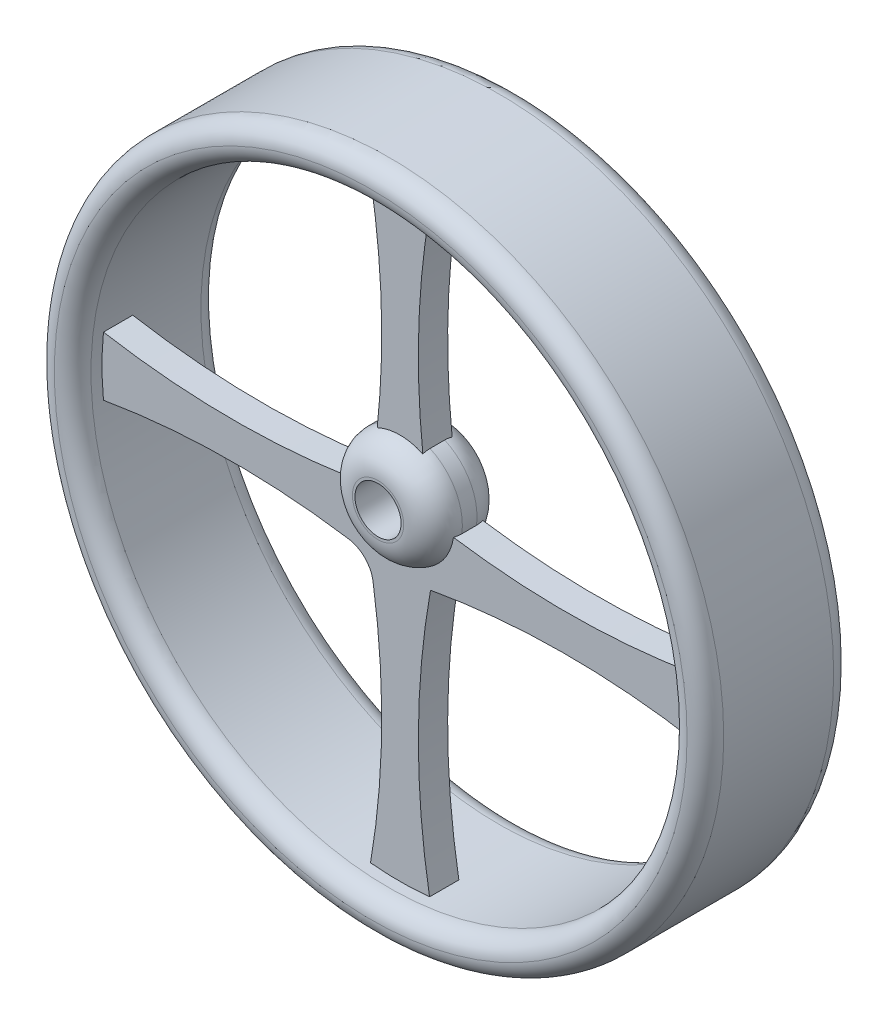
from build123d import *

# Parameters (mm, degrees)
BOSS_EXTRUDE2_DEPTH      = 3.81
BOSS_EXTRUDE2_DEPTH_BACK = 8.89
SKETCH1_R                = 28.999999992
SKETCH1_R_2              = 25.824999992
SKETCH8_R                = 4.7625
BOSS_EXTRUDE3_DEPTH      = 3.175
BOSS_EXTRUDE4_DEPTH      = 1.27
CIRPATTERN1_COUNT        = 4
F_3_0MM_DOWEL_HOLE2_D    = 4
FILLET1_R                = 1.5875
FILLET2_R                = 2.54


# Some blends are built 0.0001 mm under size
with BuildPart() as part:
    # Sketch1 → Boss-Extrude2 (new, two sides: drawn at the far end of the back side and taken through both)
    with BuildSketch(Plane.XY.offset(-BOSS_EXTRUDE2_DEPTH_BACK)):
        Circle(SKETCH1_R)
        Circle(SKETCH1_R_2, mode=Mode.SUBTRACT)
    extrude(amount=BOSS_EXTRUDE2_DEPTH + BOSS_EXTRUDE2_DEPTH_BACK)



with BuildPart() as body_2:
    # Sketch8 → Boss-Extrude3 (new, symmetric)
    with BuildSketch(Plane.XY):
        with Locations((0, 3)):
            Circle(SKETCH8_R)
    extrude(amount=BOSS_EXTRUDE3_DEPTH, both=True)


with BuildPart() as part_1:
    add(part.part)

    add(body_2.part)  # Boss-Extrude4 merges body 2
    # Sketch9 → Boss-Extrude4 (add, symmetric)
    with BuildSketch(Plane.XY):
        with BuildLine():
            Line((3.175, 0), (-3.175, 0))
            ThreePointArc((-3.175, 0), (-1.5875, 14.412836072), (-3.175, 28.825672144))
            Line((-3.175, 28.825672144), (3.175, 28.825672144))
            ThreePointArc((3.175, 28.825672144), (1.5875, 14.412836072), (3.175, 0))
        make_face()
    boss_extrude4 = extrude(amount=BOSS_EXTRUDE4_DEPTH, both=True)

    # CirPattern1: Boss-Extrude4 ×4 about axis
    cirpattern1_axis = Axis((0, 0, 0), (0, 0, 1))
    for i in range(1, CIRPATTERN1_COUNT):
        add(boss_extrude4.rotate(cirpattern1_axis, i * 360 / CIRPATTERN1_COUNT))

    # Ø3.0mm Dowel Hole2 (through all)
    with Locations(Plane.XY.offset(3.175)):
        with Locations((0, 3)):
            Hole(F_3_0MM_DOWEL_HOLE2_D / 2)

    # Fillet1
    fillet1_edges = [part_1.edges().sort_by_distance(p)[0] for p in [
        (-28.999999992, 0, -8.89),
        (-25.824999992, 0, -8.89),
        (-28.999999992, 0, 3.81),
        (-25.824999992, 0, 3.81),
    ]]
    fillet(fillet1_edges, radius=FILLET1_R - 0.0001)  # a hair under: the kernel refuses the full size

    # Fillet2
    # the kernel refuses this fillet: 2.54 mm, written as the material it adds along each edge
    with BuildSketch(Plane(origin=(-2.642036236, -2.642036236, -1.27), x_dir=(-0.9864638290432723, 0.16397900472098711, 0), z_dir=(0, 0, 1))) as fillet2_piece_1:
        with BuildLine():
            CenterArc((1.815741987, 2.539751853), FILLET2_R, 198.074955273, 72.725945295)
            ThreePointArc((-0.598912674, 1.751689123), (-0.305577869, 0.873751575), (0, 0))
            ThreePointArc((0, 0), (0.925622922, -0.006469447), (1.851245845, 0))
        make_face()
    extrude(amount=2.54)
    # the kernel refuses this fillet: 2.54 mm, written as the material it takes off along each edge
    with BuildSketch(Plane(origin=(0, 3, -3.175), x_dir=(1, 0, 0), z_dir=(0, -1, 0))) as fillet2_2_piece_1_section:
        with BuildLine():
            CenterArc((4.7625 - FILLET2_R, FILLET2_R), FILLET2_R, 270, 90)
            Line((4.7625 - FILLET2_R, 0), (4.7625, 0))
            Line((4.7625, 0), (4.7625, FILLET2_R))
        make_face()
    fillet2_2_piece_1 = revolve(axis=Axis((0, 3, -3.175), (0, 0, 1)), mode=Mode.PRIVATE)
    fillet2_2_piece_1 = fillet2_2_piece_1 & Plane(origin=(14.412836072, 67.807972404, -0.955463764), x_dir=(-0.21764924876751077, -0.9760270511163809, 0), z_dir=(0, 0, 1)) * Cylinder(66.220472404, 20, mode=Mode.PRIVATE)
    fillet2_2_piece_1 = fillet2_2_piece_1 - Plane(origin=(-14.412836072, 67.807972404, -0.955463764), x_dir=(-0.21764924876750993, -0.9760270511163811, 0), z_dir=(0, 0, 1)) * Cylinder(66.220472404, 20, mode=Mode.PRIVATE)
    add(fillet2_2_piece_1, mode=Mode.SUBTRACT)
    with BuildSketch(Plane(origin=(0, 3, -3.175), x_dir=(1, 0, 0), z_dir=(0, -1, 0))) as fillet2_2_piece_2_section:
        with BuildLine():
            CenterArc((4.7625 - FILLET2_R, FILLET2_R), FILLET2_R, 270, 90)
            Line((4.7625 - FILLET2_R, 0), (4.7625, 0))
            Line((4.7625, 0), (4.7625, FILLET2_R))
        make_face()
    fillet2_2_piece_2 = revolve(axis=Axis((0, 3, -3.175), (0, 0, 1)), mode=Mode.PRIVATE)
    fillet2_2_piece_2 = fillet2_2_piece_2 & Plane(origin=(67.807972404, 14.412836072, -0.955566324), x_dir=(-0.9760270511163811, 0.21764924876750982, 0), z_dir=(0, 0, 1)) * Cylinder(66.220472404, 20, mode=Mode.PRIVATE)
    fillet2_2_piece_2 = fillet2_2_piece_2 & Plane(origin=(-14.412836072, 67.807972404, -0.955566324), x_dir=(-0.21764924876750993, -0.9760270511163811, 0), z_dir=(0, 0, 1)) * Cylinder(66.220472404, 20, mode=Mode.PRIVATE)
    add(fillet2_2_piece_2, mode=Mode.SUBTRACT)
    with BuildSketch(Plane(origin=(0, 3, -3.175), x_dir=(1, 0, 0), z_dir=(0, -1, 0))) as fillet2_2_piece_3_section:
        with BuildLine():
            CenterArc((4.7625 - FILLET2_R, FILLET2_R), FILLET2_R, 270, 90)
            Line((4.7625 - FILLET2_R, 0), (4.7625, 0))
            Line((4.7625, 0), (4.7625, FILLET2_R))
        make_face()
    fillet2_2_piece_3 = revolve(axis=Axis((0, 3, -3.175), (0, 0, 1)), mode=Mode.PRIVATE)
    fillet2_2_piece_3 = split(fillet2_2_piece_3, bisect_by=Plane(origin=(3.831400091, 1.166208348, -1.27), z_dir=(0, 0, -1)), keep=Keep.TOP, mode=Mode.PRIVATE)
    add(fillet2_2_piece_3, mode=Mode.SUBTRACT)
    with BuildSketch(Plane(origin=(0, 3, -3.175), x_dir=(1, 0, 0), z_dir=(0, -1, 0))) as fillet2_2_piece_4_section:
        with BuildLine():
            CenterArc((4.7625 - FILLET2_R, FILLET2_R), FILLET2_R, 270, 90)
            Line((4.7625 - FILLET2_R, 0), (4.7625, 0))
            Line((4.7625, 0), (4.7625, FILLET2_R))
        make_face()
    fillet2_2_piece_4 = revolve(axis=Axis((0, 3, -3.175), (0, 0, 1)), mode=Mode.PRIVATE)
    fillet2_2_piece_4 = fillet2_2_piece_4 & Plane(origin=(-67.807972404, 14.412836072, -0.955566324), x_dir=(0.9760270511163809, -0.21764924876751054, 0), z_dir=(0, 0, 1)) * Cylinder(66.220472404, 20, mode=Mode.PRIVATE)
    fillet2_2_piece_4 = fillet2_2_piece_4 & Plane(origin=(-14.412836072, 67.807972404, -0.955566324), x_dir=(-0.21764924876750993, -0.9760270511163811, 0), z_dir=(0, 0, 1)) * Cylinder(66.220472404, 20, mode=Mode.PRIVATE)
    add(fillet2_2_piece_4, mode=Mode.SUBTRACT)
    with BuildSketch(Plane(origin=(0, 3, 3.175), x_dir=(1, 0, 0), z_dir=(0, -1, 0))) as fillet2_2_piece_5_section:
        with BuildLine():
            CenterArc((4.7625 - FILLET2_R, -FILLET2_R), FILLET2_R, 0, 90)
            Line((4.7625 - FILLET2_R, 0), (4.7625, 0))
            Line((4.7625, 0), (4.7625, -FILLET2_R))
        make_face()
    fillet2_2_piece_5 = revolve(axis=Axis((0, 3, 3.175), (0, 0, 1)), mode=Mode.PRIVATE)
    fillet2_2_piece_5 = fillet2_2_piece_5 & Plane(origin=(14.412836072, 67.807972404, 0.955463764), x_dir=(-0.21764924876751077, -0.9760270511163809, 0), z_dir=(0, 0, 1)) * Cylinder(66.220472404, 20, mode=Mode.PRIVATE)
    fillet2_2_piece_5 = fillet2_2_piece_5 - Plane(origin=(-14.412836072, 67.807972404, 0.955463764), x_dir=(-0.21764924876750993, -0.9760270511163811, 0), z_dir=(0, 0, 1)) * Cylinder(66.220472404, 20, mode=Mode.PRIVATE)
    add(fillet2_2_piece_5, mode=Mode.SUBTRACT)
    with BuildSketch(Plane(origin=(0, 3, 3.175), x_dir=(1, 0, 0), z_dir=(0, -1, 0))) as fillet2_2_piece_6_section:
        with BuildLine():
            CenterArc((4.7625 - FILLET2_R, -FILLET2_R), FILLET2_R, 0, 90)
            Line((4.7625 - FILLET2_R, 0), (4.7625, 0))
            Line((4.7625, 0), (4.7625, -FILLET2_R))
        make_face()
    fillet2_2_piece_6 = revolve(axis=Axis((0, 3, 3.175), (0, 0, 1)), mode=Mode.PRIVATE)
    fillet2_2_piece_6 = fillet2_2_piece_6 & Plane(origin=(67.807972404, 14.412836072, 0.955566324), x_dir=(-0.9760270511163811, 0.21764924876750982, 0), z_dir=(0, 0, 1)) * Cylinder(66.220472404, 20, mode=Mode.PRIVATE)
    fillet2_2_piece_6 = fillet2_2_piece_6 & Plane(origin=(-14.412836072, 67.807972404, 0.955566324), x_dir=(-0.21764924876750993, -0.9760270511163811, 0), z_dir=(0, 0, 1)) * Cylinder(66.220472404, 20, mode=Mode.PRIVATE)
    add(fillet2_2_piece_6, mode=Mode.SUBTRACT)
    with BuildSketch(Plane(origin=(0, 3, 3.175), x_dir=(1, 0, 0), z_dir=(0, -1, 0))) as fillet2_2_piece_7_section:
        with BuildLine():
            CenterArc((4.7625 - FILLET2_R, -FILLET2_R), FILLET2_R, 0, 90)
            Line((4.7625 - FILLET2_R, 0), (4.7625, 0))
            Line((4.7625, 0), (4.7625, -FILLET2_R))
        make_face()
    fillet2_2_piece_7 = revolve(axis=Axis((0, 3, 3.175), (0, 0, 1)), mode=Mode.PRIVATE)
    fillet2_2_piece_7 = split(fillet2_2_piece_7, bisect_by=Plane(origin=(3.831400091, 1.166208348, 1.27), z_dir=(0, 0, 1)), keep=Keep.TOP, mode=Mode.PRIVATE)
    add(fillet2_2_piece_7, mode=Mode.SUBTRACT)
    with BuildSketch(Plane(origin=(0, 3, 3.175), x_dir=(1, 0, 0), z_dir=(0, -1, 0))) as fillet2_2_piece_8_section:
        with BuildLine():
            CenterArc((4.7625 - FILLET2_R, -FILLET2_R), FILLET2_R, 0, 90)
            Line((4.7625 - FILLET2_R, 0), (4.7625, 0))
            Line((4.7625, 0), (4.7625, -FILLET2_R))
        make_face()
    fillet2_2_piece_8 = revolve(axis=Axis((0, 3, 3.175), (0, 0, 1)), mode=Mode.PRIVATE)
    fillet2_2_piece_8 = fillet2_2_piece_8 & Plane(origin=(-67.807972404, 14.412836072, 0.955566324), x_dir=(0.9760270511163809, -0.21764924876751054, 0), z_dir=(0, 0, 1)) * Cylinder(66.220472404, 20, mode=Mode.PRIVATE)
    fillet2_2_piece_8 = fillet2_2_piece_8 & Plane(origin=(-14.412836072, 67.807972404, 0.955566324), x_dir=(-0.21764924876750993, -0.9760270511163811, 0), z_dir=(0, 0, 1)) * Cylinder(66.220472404, 20, mode=Mode.PRIVATE)
    add(fillet2_2_piece_8, mode=Mode.SUBTRACT)


solid = part_1.part
